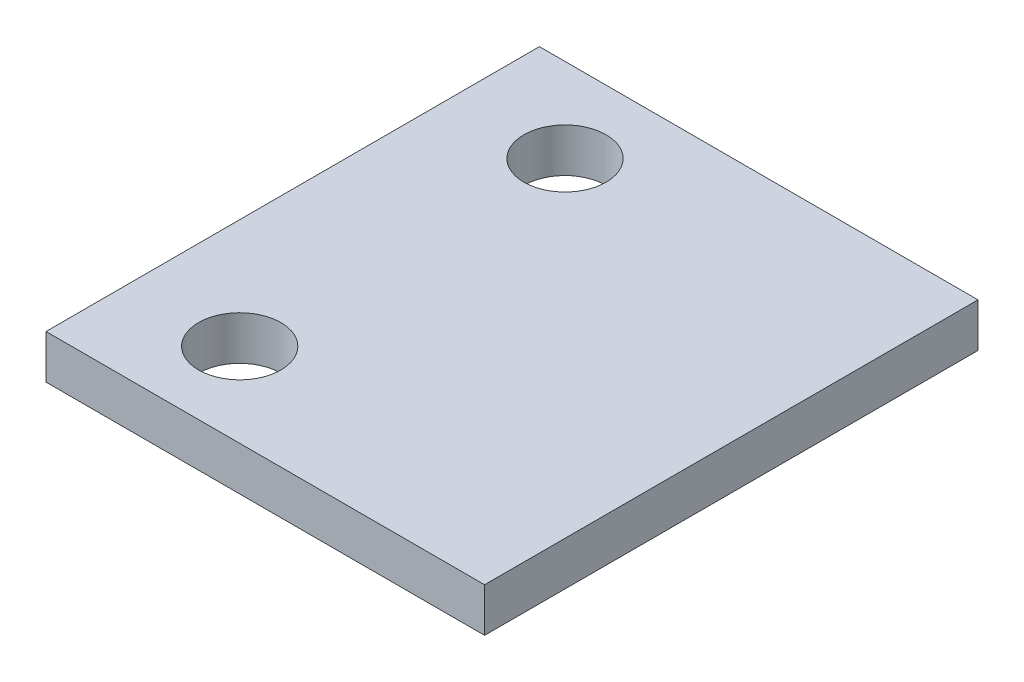
from build123d import *

# Parameters (mm, degrees)
SKETCH1_W           = 50.8
SKETCH1_H           = 57.15
BOSS_EXTRUDE1_DEPTH = 5.08
SKETCH2_R           = 4.7625
CUT_EXTRUDE1_DEPTH  = 5.08


with BuildPart() as part:
    # Sketch1 → Boss-Extrude1 (new body)
    with BuildSketch(Plane(origin=(0, 0, 0), x_dir=(1, 0, 0), z_dir=(0, 1, 0))):
        Rectangle(SKETCH1_W, SKETCH1_H)
    extrude(amount=BOSS_EXTRUDE1_DEPTH)

    # Sketch2 → Cut-Extrude1 (cut)
    with BuildSketch(Plane(origin=(0, 5.08, 0), x_dir=(1, 0, 0), z_dir=(0, 1, 0))):
        with Locations((-12.7, 18.837656)):
            Circle(SKETCH2_R)
        with Locations((-12.7, -18.837656)):
            Circle(SKETCH2_R)
    extrude(amount=-CUT_EXTRUDE1_DEPTH, mode=Mode.SUBTRACT)


solid = part.part
